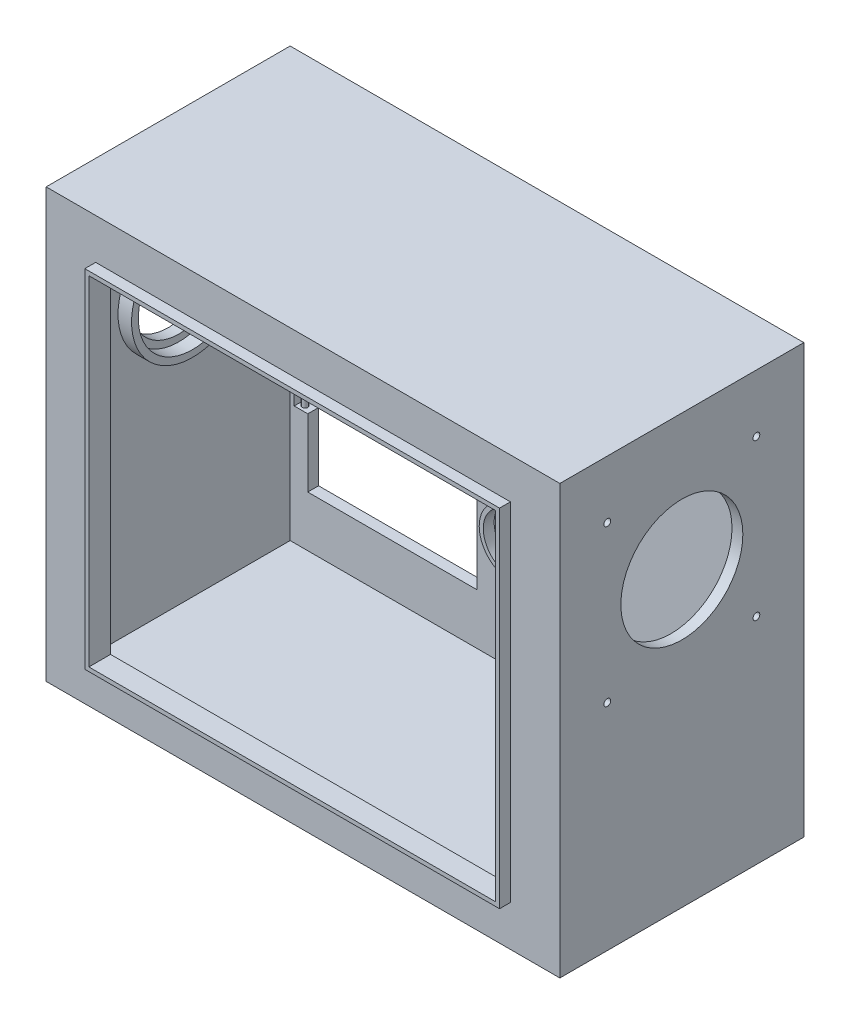
from build123d import *

# Parameters (mm, degrees)
CROQUIS1_W               = 379
CROQUIS1_H               = 316
SALIENTE_EXTRUIR1_DEPTH  = 180
VACIADO1_T               = -8
CROQUIS2_R               = 35
CORTAR_EXTRUIR4_DEPTH    = 20
CROQUIS4_R               = 45
CROQUIS4_R_2             = 40
SALIENTE_EXTRUIR4_DEPTH  = 10
CORTAR_EXTRUIR6_START    = -10
CROQUIS6_R               = 45
CORTAR_EXTRUIR6_DEPTH    = 10
CROQUIS7_R               = 24
CROQUIS7_R_2             = 21
SALIENTE_EXTRUIR9_DEPTH  = 18
CROQUIS11_W              = 363
CROQUIS11_H              = 300
CROQUIS11_W_2            = 300
CROQUIS11_H_2            = 250
SALIENTE_EXTRUIR10_DEPTH = 8
CROQUIS12_W              = 306
CROQUIS12_H              = 256
CROQUIS12_W_2            = 300
CROQUIS12_H_2            = 250
SALIENTE_EXTRUIR11_DEPTH = 8
CROQUIS20_R              = 21
CROQUIS20_R_2            = 18.5
SALIENTE_EXTRUIR19_DEPTH = 10
TALADRO_ROSCADO_M63_D    = 5
CROQUIS28_W              = 125
CROQUIS28_H              = 225
CORTAR_EXTRUIR7_DEPTH    = 8
CROQUIS29_W              = 10
CROQUIS29_H              = 20
CORTAR_EXTRUIR9_DEPTH    = 8
CROQUIS30_R              = 2
SALIENTE_EXTRUIR20_DEPTH = 9
CROQUIS31_R              = 2
SALIENTE_EXTRUIR21_DEPTH = 9


with BuildPart() as part:
    # Croquis1 → Saliente-Extruir1 (new body)
    with BuildSketch(Plane.XY):
        Rectangle(CROQUIS1_W, CROQUIS1_H)
    extrude(amount=SALIENTE_EXTRUIR1_DEPTH)

    # Vaciado1
    vaciado1_openings = [part.faces().sort_by_distance(p)[0] for p in [
        (0, 0, 180),
    ]]
    offset(amount=VACIADO1_T, openings=vaciado1_openings, kind=Kind.INTERSECTION)

    # Croquis2 → Cortar-Extruir4 (cut)
    with BuildSketch(Plane.ZY.offset(189.5)):
        with Locations((90, 58)):
            Circle(CROQUIS2_R)
    extrude(amount=-CORTAR_EXTRUIR4_DEPTH, mode=Mode.SUBTRACT)

    # Croquis4 → Saliente-Extruir4 (add)
    with BuildSketch(Plane(origin=(-181.5, 0, 0), x_dir=(0, 0, -1), z_dir=(1, 0, 0))):
        with Locations((-90, 58)):
            Circle(CROQUIS4_R)
        with Locations((-90, 58)):
            Circle(CROQUIS4_R_2, mode=Mode.SUBTRACT)
    extrude(amount=SALIENTE_EXTRUIR4_DEPTH)

    # Croquis6 → Cortar-Extruir6 (cut)
    with BuildSketch(Plane(origin=(189.5, 0, 0), x_dir=(0, 0, -1), z_dir=(1, 0, 0)).offset(CORTAR_EXTRUIR6_START)):
        with Locations((-90, 58)):
            Circle(CROQUIS6_R)
    extrude(amount=CORTAR_EXTRUIR6_DEPTH, mode=Mode.SUBTRACT)

    # Croquis7 → Saliente-Extruir9 (add)
    with BuildSketch(Plane.XY.offset(8)):
        with Locations((0, -53)):
            Circle(CROQUIS7_R)
        with Locations((0, -53)):
            Circle(CROQUIS7_R_2, mode=Mode.SUBTRACT)
    extrude(amount=SALIENTE_EXTRUIR9_DEPTH)

    # Croquis11 → Saliente-Extruir10 (add)
    with BuildSketch(Plane.XY.offset(180)):
        Rectangle(CROQUIS11_W, CROQUIS11_H)
        Rectangle(CROQUIS11_W_2, CROQUIS11_H_2, mode=Mode.SUBTRACT)
    extrude(amount=-SALIENTE_EXTRUIR10_DEPTH)

    # Croquis12 → Saliente-Extruir11 (add)
    with BuildSketch(Plane.XY.offset(180)):
        Rectangle(CROQUIS12_W, CROQUIS12_H)
        Rectangle(CROQUIS12_W_2, CROQUIS12_H_2, mode=Mode.SUBTRACT)
    extrude(amount=SALIENTE_EXTRUIR11_DEPTH)

    # Croquis20 → Saliente-Extruir19 (add)
    with BuildSketch(Plane.XY.offset(8)):
        with Locations((0, -53)):
            Circle(CROQUIS20_R)
        with Locations((0, -53)):
            Circle(CROQUIS20_R_2, mode=Mode.SUBTRACT)
    extrude(amount=SALIENTE_EXTRUIR19_DEPTH)

    # Taladro roscado M63 (through all)
    with Locations(Plane(origin=(-189.5, 115.5, 35), x_dir=(0, 0, -1), z_dir=(-1, 0, 0))):
        with Locations((0, 0), (-110, 0), (-110, 115), (0, 115)):
            Hole(TALADRO_ROSCADO_M63_D / 2)

    # Croquis28 → Cortar-Extruir7 (cut)
    with BuildSketch(Plane(origin=(0, 0, 0), x_dir=(-1, 0, 0), z_dir=(0, 0, -1))):
        with Locations((106, 0)):
            Rectangle(CROQUIS28_W, CROQUIS28_H)
    extrude(amount=-CORTAR_EXTRUIR7_DEPTH, mode=Mode.SUBTRACT)

    # Croquis29 → Cortar-Extruir9 (cut)
    with BuildSketch(Plane(origin=(0, 0, 0), x_dir=(-1, 0, 0), z_dir=(0, 0, -1))):
        with Locations((173.5, 52.5)):
            Rectangle(CROQUIS29_W, CROQUIS29_H)
        with Locations((173.5, -52.5)):
            Rectangle(CROQUIS29_W, CROQUIS29_H)
    extrude(amount=-CORTAR_EXTRUIR9_DEPTH, mode=Mode.SUBTRACT)

    # Croquis30 → Saliente-Extruir20 (add)
    with BuildSketch(Plane(origin=(0, 42.5, 0), x_dir=(1, 0, 0), z_dir=(0, 1, 0))):
        with Locations((-174.5, -4)):
            Circle(CROQUIS30_R)
    extrude(amount=SALIENTE_EXTRUIR20_DEPTH)

    # Croquis31 → Saliente-Extruir21 (add)
    with BuildSketch(Plane(origin=(0, -62.5, 0), x_dir=(1, 0, 0), z_dir=(0, 1, 0))):
        with Locations((-174.5, -4)):
            Circle(CROQUIS31_R)
    extrude(amount=SALIENTE_EXTRUIR21_DEPTH)


solid = part.part
